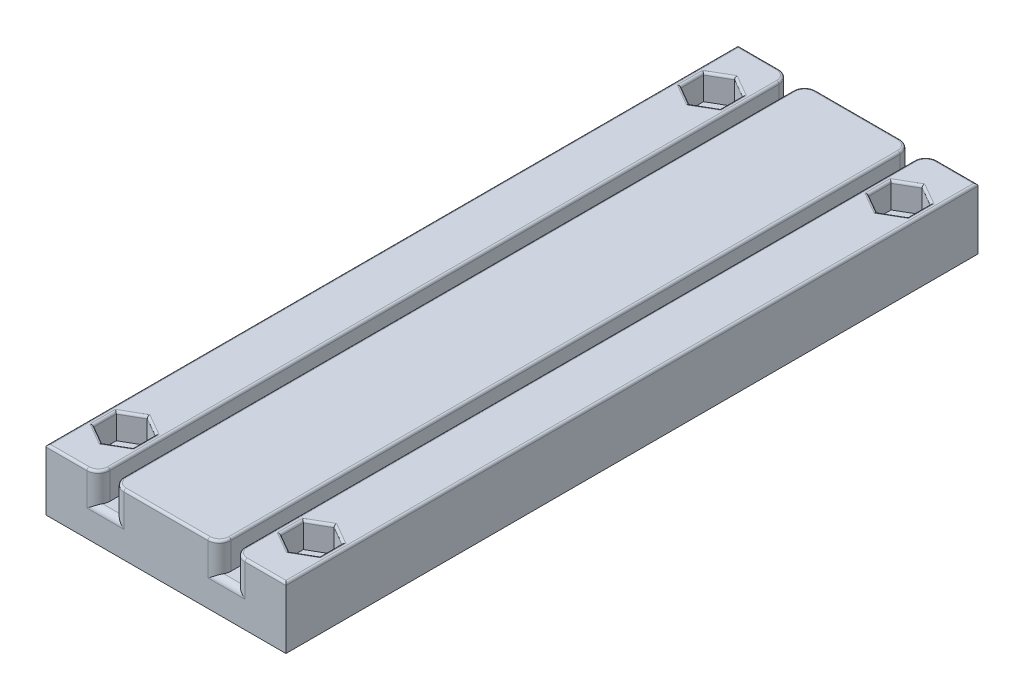
from build123d import *

# Parameters (mm, degrees)
BOSS_EXTRUDE1_DEPTH = 152.4
SKETCH3_R           = 1.89865
CUT_EXTRUDE1_DEPTH  = 13.462
CUT_EXTRUDE2_DEPTH  = 5.588
FILLET2_R           = 0.508
FILLET3_R           = 2.54
FILLET4_R           = 1.27
SKETCH5_W           = 14.04493
SKETCH5_H           = 66.675
CUT_EXTRUDE3_DEPTH  = 9.398
FILLET6_R           = 2.54
FILLET7_R           = 2.54


with BuildPart() as part:
    # Sketch1 → Boss-Extrude1 (new body)
    with BuildSketch(Plane.XY):
        Polygon((0, 0), (11.53414, 0), (11.53414, -6.35), (14.63421, -6.35), (14.63421, 0), (38.20414, 0), (38.20414, -6.35), (41.30421, -6.35), (41.30421, 0), (52.83835, 0), (52.83835, -13.462), (0, -13.462), align=None)
    extrude(amount=BOSS_EXTRUDE1_DEPTH)

    # Sketch3 → Cut-Extrude1 (cut)
    with BuildSketch(Plane(origin=(0, 0, 0), x_dir=(1, 0, 0), z_dir=(0, 1, 0))):
        with Locations(Location((5.76707, -11.54197088, 0), (0, 0, 270))):
            Circle(SKETCH3_R)
        with Locations(Location((47.07128, -11.53414, 0), (0, 0, 270))):
            Circle(SKETCH3_R)
        with Locations(Location((5.76707, -140.86586, 0), (0, 0, 270))):
            Circle(SKETCH3_R)
        with Locations(Location((47.07128, -140.86586, 0), (0, 0, 270))):
            Circle(SKETCH3_R)
    extrude(amount=-CUT_EXTRUDE1_DEPTH, mode=Mode.SUBTRACT)

    # Sketch4 → Cut-Extrude2 (cut)
    with BuildSketch(Plane(origin=(0, 0, 0), x_dir=(1, 0, 0), z_dir=(0, 1, 0))):
        Polygon((10.08507, -9.048972418), (5.76707, -6.555973955), (1.44907, -9.048972418), (1.44907, -14.034969342), (5.76707, -16.527967805), (10.08507, -14.034969342), align=None)
        Polygon((51.38928, -9.041141538), (47.07128, -6.548143075), (42.75328, -9.041141538), (42.75328, -14.027138462), (47.07128, -16.520136925), (51.38928, -14.027138462), align=None)
        Polygon((10.08507, -143.358858462), (10.08507, -138.372861538), (5.76707, -135.879863075), (1.44907, -138.372861538), (1.44907, -143.358858462), (5.76707, -145.851856925), align=None)
        Polygon((47.07128, -145.940568228), (51.350866879, -143.469747591), (51.350866879, -138.528106318), (47.07128, -136.057285681), (42.791693121, -138.528106318), (42.791693121, -143.469747591), align=None)
    extrude(amount=-CUT_EXTRUDE2_DEPTH, mode=Mode.SUBTRACT)

    # Fillet2
    fillet2_edges = [part.edges().sort_by_distance(p)[0] for p in [
        (5.76707, 0, 0),
        (26.419175, 0, 0),
        (47.07128, 0, 152.4),
        (47.07128, 0, 0),
        (0, 0, 76.2),
        (11.53414, 0, 76.2),
        (14.63421, 0, 76.2),
        (38.20414, 0, 76.2),
        (41.30421, 0, 76.2),
        (52.83835, 0, 76.2),
        (26.419175, 0, 152.4),
        (5.76707, 0, 152.4),
        (51.38928, 0, 11.53414),
        (49.23028, 0, 7.794642306),
        (44.91228, 0, 7.794642306),
        (42.75328, 0, 11.53414),
        (44.91228, 0, 15.273637694),
        (49.23028, 0, 15.273637694),
        (7.92607, 0, 144.605357694),
        (10.08507, 0, 140.86586),
        (7.92607, 0, 137.126362306),
        (3.60807, 0, 137.126362306),
        (1.44907, 0, 140.86586),
        (3.60807, 0, 144.605357694),
        (44.931486561, 0, 144.705157909),
        (49.211073439, 0, 144.705157909),
        (51.350866879, 0, 140.998926955),
        (49.211073439, 0, 137.292696),
        (44.931486561, 0, 137.292696),
        (42.791693121, 0, 140.998926955),
        (10.08507, 0, 11.54197088),
        (7.92607, 0, 7.802473186),
        (3.60807, 0, 7.802473186),
        (1.44907, 0, 11.54197088),
        (3.60807, 0, 15.281468573),
        (7.92607, 0, 15.281468573),
    ]]
    fillet(fillet2_edges, radius=FILLET2_R)

    # Fillet3
    # the kernel refuses this fillet: 2.54 mm, written as the material it takes off along each edge
    with BuildSketch(Plane(origin=(8.99414, 0, 2.54), x_dir=(1, 0, 0), z_dir=(0, 0, 1))) as fillet3_piece_1:
        with BuildLine():
            CenterArc((2.032, -0.508), 0.508, 0, 90)
            Line((2.54, -0.508), (2.54, 0))
            Line((2.54, 0), (2.032, 0))
        make_face()
    revolve(axis=Axis((8.99414, 0, 2.54), (0, 1, 0)), revolution_arc=90, mode=Mode.SUBTRACT)
    with BuildSketch(Plane(origin=(8.99414, 0, 149.86), x_dir=(0, 0, 1), z_dir=(-1, 0, 0))) as fillet3_piece_2:
        with BuildLine():
            CenterArc((2.032, -0.508), 0.508, 0, 90)
            Line((2.54, -0.508), (2.54, 0))
            Line((2.54, 0), (2.032, 0))
        make_face()
    revolve(axis=Axis((8.99414, 0, 149.86), (0, 1, 0)), revolution_arc=90, mode=Mode.SUBTRACT)
    with BuildSketch(Plane(origin=(35.66414, 0, 2.54), x_dir=(1, 0, 0), z_dir=(0, 0, 1))) as fillet3_piece_3:
        with BuildLine():
            CenterArc((2.032, -0.508), 0.508, 0, 90)
            Line((2.54, -0.508), (2.54, 0))
            Line((2.54, 0), (2.032, 0))
        make_face()
    revolve(axis=Axis((35.66414, 0, 2.54), (0, 1, 0)), revolution_arc=90, mode=Mode.SUBTRACT)
    with BuildSketch(Plane(origin=(17.17421, 0, 2.54), x_dir=(0, 0, -1), z_dir=(1, 0, 0))) as fillet3_piece_4:
        with BuildLine():
            CenterArc((2.032, -0.508), 0.508, 0, 90)
            Line((2.54, -0.508), (2.54, 0))
            Line((2.54, 0), (2.032, 0))
        make_face()
    revolve(axis=Axis((17.17421, 0, 2.54), (0, 1, 0)), revolution_arc=90, mode=Mode.SUBTRACT)
    with BuildSketch(Plane(origin=(35.66414, 0, 149.86), x_dir=(0, 0, 1), z_dir=(-1, 0, 0))) as fillet3_piece_5:
        with BuildLine():
            CenterArc((2.032, -0.508), 0.508, 0, 90)
            Line((2.54, -0.508), (2.54, 0))
            Line((2.54, 0), (2.032, 0))
        make_face()
    revolve(axis=Axis((35.66414, 0, 149.86), (0, 1, 0)), revolution_arc=90, mode=Mode.SUBTRACT)
    with BuildSketch(Plane(origin=(17.17421, 0, 149.86), x_dir=(-1, 0, 0), z_dir=(0, 0, -1))) as fillet3_piece_6:
        with BuildLine():
            CenterArc((2.032, -0.508), 0.508, 0, 90)
            Line((2.54, -0.508), (2.54, 0))
            Line((2.54, 0), (2.032, 0))
        make_face()
    revolve(axis=Axis((17.17421, 0, 149.86), (0, 1, 0)), revolution_arc=90, mode=Mode.SUBTRACT)
    with BuildSketch(Plane(origin=(43.84421, 0, 2.54), x_dir=(0, 0, -1), z_dir=(1, 0, 0))) as fillet3_piece_7:
        with BuildLine():
            CenterArc((2.032, -0.508), 0.508, 0, 90)
            Line((2.54, -0.508), (2.54, 0))
            Line((2.54, 0), (2.032, 0))
        make_face()
    revolve(axis=Axis((43.84421, 0, 2.54), (0, 1, 0)), revolution_arc=90, mode=Mode.SUBTRACT)
    with BuildSketch(Plane(origin=(43.84421, 0, 149.86), x_dir=(-1, 0, 0), z_dir=(0, 0, -1))) as fillet3_piece_8:
        with BuildLine():
            CenterArc((2.032, -0.508), 0.508, 0, 90)
            Line((2.54, -0.508), (2.54, 0))
            Line((2.54, 0), (2.032, 0))
        make_face()
    revolve(axis=Axis((43.84421, 0, 149.86), (0, 1, 0)), revolution_arc=90, mode=Mode.SUBTRACT)
    with BuildSketch(Plane(origin=(11.53414, 0, 0), x_dir=(-1, 0, 0), z_dir=(0, -1, 0)), Plane(origin=(38.20414, 0, 0), x_dir=(-1, 0, 0), z_dir=(0, -1, 0)), Plane(origin=(14.63421, -6.35, 0), x_dir=(1, 0, 0), z_dir=(0, 1, 0)), Plane(origin=(41.30421, -6.35, 0), x_dir=(1, 0, 0), z_dir=(0, 1, 0)), Plane(origin=(11.53414, 0, 152.4), x_dir=(0, 0, -1), z_dir=(0, -1, 0))) as fillet3_piece_9:
        with BuildLine():
            CenterArc((FILLET3_R, -FILLET3_R), FILLET3_R, 90, 90)
            Line((0, -FILLET3_R), (0, 0))
            Line((0, 0), (FILLET3_R, 0))
        make_face()
    extrude(amount=6.35, mode=Mode.SUBTRACT)
    with BuildSketch(Plane(origin=(41.30421, -6.35, 152.4), x_dir=(1, 0, 0), z_dir=(0, 1, 0)), Plane(origin=(14.63421, -6.35, 152.4), x_dir=(1, 0, 0), z_dir=(0, 1, 0)), Plane(origin=(38.20414, 0, 152.4), x_dir=(-1, 0, 0), z_dir=(0, -1, 0))) as fillet3_piece_10:
        with BuildLine():
            CenterArc((FILLET3_R, FILLET3_R), FILLET3_R, 180, 90)
            Line((0, FILLET3_R), (0, 0))
            Line((0, 0), (FILLET3_R, 0))
        make_face()
    extrude(amount=6.35, mode=Mode.SUBTRACT)

    # Fillet4
    fillet4_edges = [part.edges().sort_by_distance(p)[0] for p in [
        (13.084175, -6.35, 0),
        (39.754175, -6.35, 0),
        (39.754175, -6.35, 152.4),
        (13.084175, -6.35, 152.4),
    ]]
    fillet(fillet4_edges, radius=FILLET4_R)

    # Sketch5 → Cut-Extrude3 (cut)
    with BuildSketch(Plane.XZ.offset(13.462)):
        with Locations((26.419175, 38.1)):
            Rectangle(SKETCH5_W, SKETCH5_H)
        with Locations((26.419175, 114.3)):
            Rectangle(SKETCH5_W, SKETCH5_H)
    extrude(amount=-CUT_EXTRUDE3_DEPTH, mode=Mode.SUBTRACT)

    # Fillet6
    fillet6_edges = [part.edges().sort_by_distance(p)[0] for p in [
        (19.39671, -8.763, 4.7625),
        (19.39671, -8.763, 71.4375),
        (33.44164, -8.763, 71.4375),
        (33.44164, -8.763, 4.7625),
        (19.39671, -8.763, 80.9625),
        (19.39671, -8.763, 147.6375),
        (33.44164, -8.763, 147.6375),
        (33.44164, -8.763, 80.9625),
    ]]
    fillet(fillet6_edges, radius=FILLET6_R)

    # Fillet7
    fillet7_edges = [part.edges().sort_by_distance(p)[0] for p in [
        (26.419175, -4.064, 80.9625),
        (19.39671, -4.064, 114.3),
        (33.44164, -4.064, 114.3),
        (26.419175, -4.064, 147.6375),
        (32.697691224, -4.064, 146.893551224),
        (32.697691224, -4.064, 81.706448776),
        (20.140658776, -4.064, 146.893551224),
        (20.140658776, -4.064, 81.706448776),
        (26.419175, -4.064, 4.7625),
        (19.39671, -4.064, 38.1),
        (33.44164, -4.064, 38.1),
        (26.419175, -4.064, 71.4375),
        (32.697691224, -4.064, 70.693551224),
        (32.697691224, -4.064, 5.506448776),
        (20.140658776, -4.064, 70.693551224),
        (20.140658776, -4.064, 5.506448776),
    ]]
    fillet(fillet7_edges, radius=FILLET7_R)


solid = part.part
